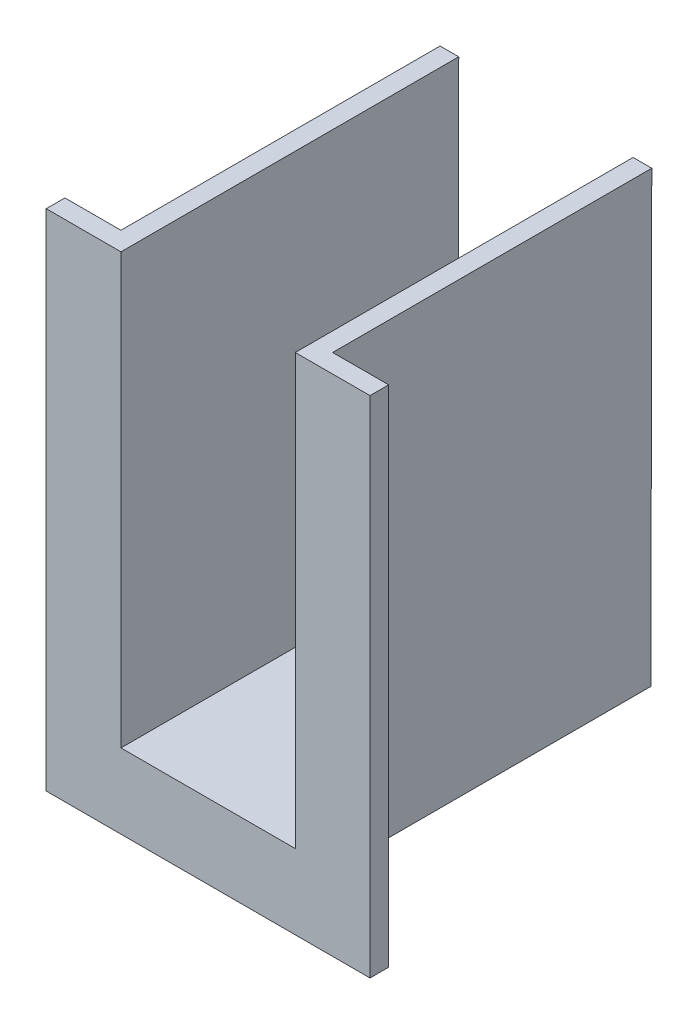
from build123d import *

# Parameters (mm, degrees)
EXTRUDE1_START   = -15.478468141
EXTRUDE1_DEPTH   = 2.38125
EXTRUDE1_START_2 = 9.127781859
EXTRUDE1_2_DEPTH = 2.38125
EXTRUDE1_START_3 = -13.097218141
EXTRUDE1_3_DEPTH = 22.225
EXTRUDE2_DEPTH   = 2.38125


# Read off the part's stored shape, not the designer's step: Extrude1
with BuildPart() as part:
    # Extrude1 outline → Extrude1 (new body)
    with BuildSketch(Plane.YZ.offset(EXTRUDE1_START)):
        Polygon((863.6, 0), (863.6, -40.573158736), (920.75, -40.682134014), (920.75, 0), align=None)
    extrude(amount=EXTRUDE1_DEPTH)



with BuildPart() as body_2:
    # Extrude1 2 outline → Extrude1 2 (new body)
    with BuildSketch(Plane.YZ.offset(EXTRUDE1_START_2)):
        Polygon((863.6, 0), (863.6, -40.573158736), (920.75, -40.682134014), (920.75, 0), align=None)
    extrude(amount=EXTRUDE1_2_DEPTH)


with BuildPart() as part_1:
    add(part.part)

    add(body_2.part)  # Extrude1 3 merges body 2
    # Extrude1 3 outline → Extrude1 3 (add)
    with BuildSketch(Plane.YZ.offset(EXTRUDE1_START_3)):
        Polygon((865.98125, 0), (863.6, 0), (863.6, -40.573158736), (865.98125, -40.577699373), align=None)
    extrude(amount=EXTRUDE1_3_DEPTH)

    # Sketch2 → Extrude2 (add)
    with BuildSketch(Plane.XY):
        Polygon((18.652781859, 920.75), (9.127781859, 920.75), (9.127781859, 865.98125), (-13.097218141, 865.98125), (-13.097218141, 920.75), (-22.622218141, 920.75), (-22.622218141, 856.45625), (18.652781859, 856.45625), align=None)
    extrude(amount=EXTRUDE2_DEPTH)


solid = part_1.part
